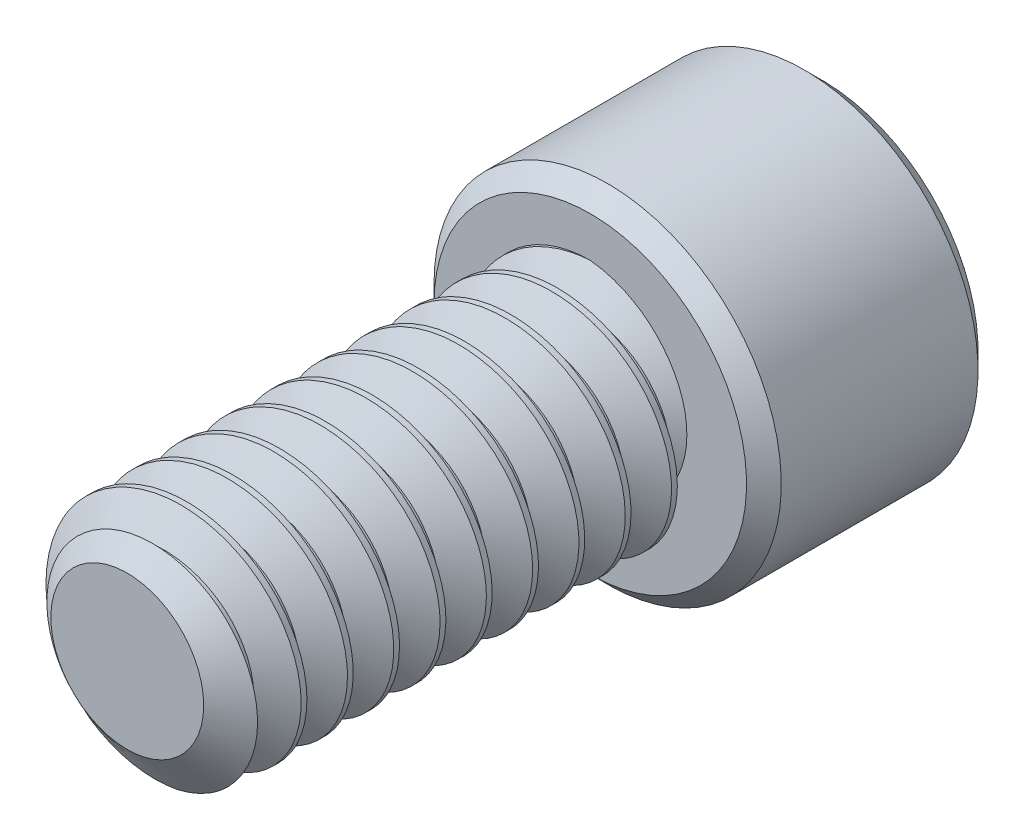
from build123d import *

# Parameters (mm, degrees)
SKETCH1_R          = 3.175
EXTRUDE1_DEPTH     = 12.7
CUT_SWEEP1_PITCH   = 1.27
SKETCH6_R          = 4.7625
EXTRUDE2_DEPTH     = 6.35
CUT_EXTRUDE1_DEPTH = 3.571875
CHAMFER1_SIZE      = 0.47625


with BuildPart() as part:
    # Sketch1 → Extrude1 (new body)
    with BuildSketch(Plane.XY):
        Circle(SKETCH1_R)
    extrude(amount=-EXTRUDE1_DEPTH)

    # Cut-Sweep1: the profile of Sketch3 profile screwed along a right-hand helix of 11 turns, 6 arcs to a turn; built about Z, then put on its axis
    cut_sweep1_z = Axis((0, 0, 0), (0, 0, 1))
    cut_sweep1_corners = [(3.1753, 0, -1.111423205), (2.350110803, 0, -0.635), (2.350110803, 0, -0.47625), (3.1753, 0, 0.000173205)]
    with BuildLine(mode=Mode.PRIVATE) as cut_sweep1_profile:
        Line(cut_sweep1_corners[0], cut_sweep1_corners[1])
        Line(cut_sweep1_corners[1], cut_sweep1_corners[2])
        Line(cut_sweep1_corners[2], cut_sweep1_corners[3])
        Line(cut_sweep1_corners[3], cut_sweep1_corners[0])
    cut_sweep1_cap = Face(cut_sweep1_profile.wire())
    cut_sweep1_turn_angles = [0, 30, 60, 90, 120, 150, 180, 210, 240, 270, 300, 330, 360]
    cut_sweep1_turn_weights = [1, 0.8660254037844387, 1, 0.8660254037844387, 1, 0.8660254037844387, 1, 0.8660254037844387, 1, 0.8660254037844387, 1, 0.8660254037844387, 1]
    cut_sweep1_turn_rails = [Edge.make_bspline([Vector(p[0], p[1], 0).rotate(cut_sweep1_z, cut_sweep1_turn_angles[k]) / cut_sweep1_turn_weights[k] + Vector(0, 0, p[2] + CUT_SWEEP1_PITCH * cut_sweep1_turn_angles[k] / 360) for k in range(13)], [0, 0, 0, 1, 1, 2, 2, 3, 3, 4, 4, 5, 5, 6, 6, 6], 2, cut_sweep1_turn_weights) for p in cut_sweep1_corners]
    cut_sweep1_turn_sides = [Face.make_surface_from_curves(cut_sweep1_turn_rails[p[0]], cut_sweep1_turn_rails[p[1]]) for p in [(0, 1), (1, 2), (2, 3), (3, 0)]]
    cut_sweep1 = Plane(origin=(0, 0, 0), x_dir=(0, 1, 0), z_dir=(0, 0, -1)) * Solid(Shell([*[p.moved(Location((0, 0, CUT_SWEEP1_PITCH * i))) for i in range(11) for p in cut_sweep1_turn_sides], cut_sweep1_cap, cut_sweep1_cap.rotate(cut_sweep1_z, 3960).moved(Location((0, 0, CUT_SWEEP1_PITCH * 3960 / 360)))]))
    add(cut_sweep1, mode=Mode.SUBTRACT)

    # Sketch4 → Cut-Revolve1 (revolve, cut)
    with BuildSketch(Plane(origin=(0, 0, 0), x_dir=(0, 0, -1), z_dir=(1, 0, 0)), mode=Mode.PRIVATE) as cut_revolve1_sk:
        Polygon((0.755446349, 3.175), (0, 2.096110803), (0, 3.175), align=None)
    revolve(cut_revolve1_sk.sketch.rotate(Axis((0, 0, 0), (0, 0, -1)), 229.892048011), axis=Axis((0, 0, 0), (0, 0, -1)), mode=Mode.SUBTRACT)

    # Sketch6 → Extrude2 (add)
    with BuildSketch(Plane(origin=(0, 0, -12.7), x_dir=(-1, 0, 0), z_dir=(0, 0, -1))):
        Circle(SKETCH6_R)
    extrude(amount=EXTRUDE2_DEPTH)

    # Sketch7 → Cut-Extrude1 (cut)
    with BuildSketch(Plane(origin=(0, 0, -19.05), x_dir=(-1, 0, 0), z_dir=(0, 0, -1))):
        Polygon((0, 2.749630657), (-2.38125, 1.374815329), (-2.38125, -1.374815329), (0, -2.749630657), (2.38125, -1.374815329), (2.38125, 1.374815329), align=None)
    extrude(amount=-CUT_EXTRUDE1_DEPTH, mode=Mode.SUBTRACT)

    # Cut-Extrude2 cone 1 section (through the dimple's axis) → Cut-Extrude2 (revolve, cut)
    with BuildSketch(Plane(origin=(0, 0, -19.05), x_dir=(0, 1, 0), z_dir=(1, 0, 0))):
        Polygon((0, 0), (2.749630657, 0), (0, 2.749630657), align=None)
    revolve(axis=Axis((0, 0, -19.05), (0, 0, 1)), mode=Mode.SUBTRACT)

    # Chamfer1
    chamfer1_edges = [part.edges().sort_by_distance(p)[0] for p in [
        (4.7625, 0, -12.7),
        (4.7625, 0, -19.05),
    ]]
    chamfer(chamfer1_edges, length=CHAMFER1_SIZE)


solid = part.part
